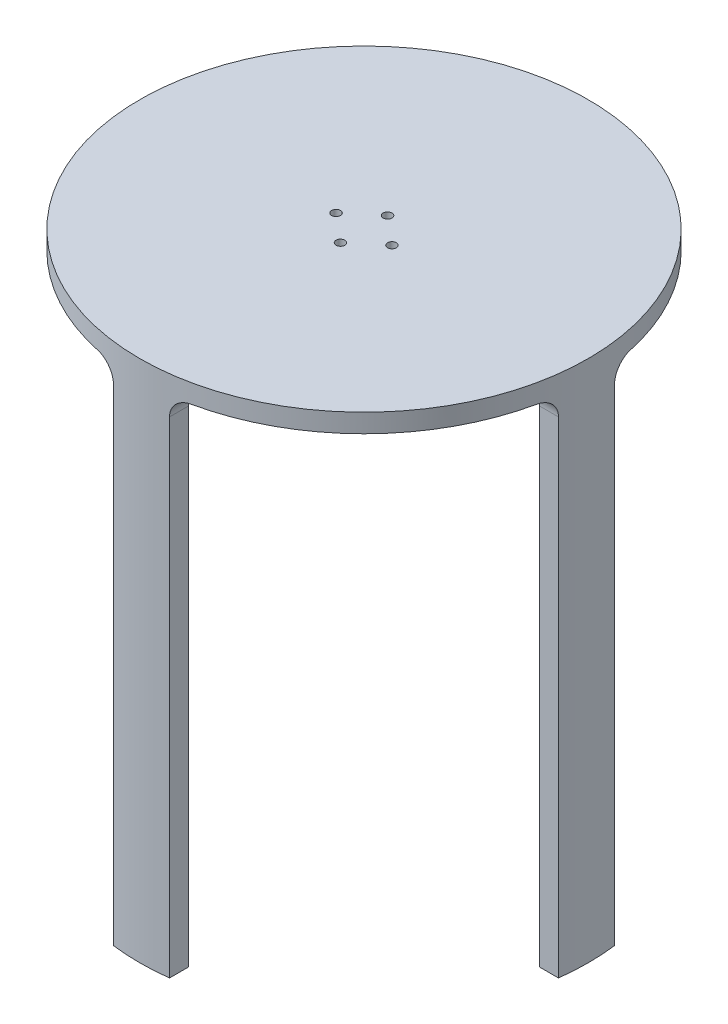
from build123d import *

# Parameters (mm, degrees)
BOSS_EXTRUDE1_DEPTH = 171.45
SKETCH2_R           = 76.2
BOSS_EXTRUDE2_DEPTH = 6.35
SKETCH3_R           = 1.5
CUT_EXTRUDE1_DEPTH  = 6.35
FILLET1_R           = 6.35


with BuildPart() as part:
    # Sketch1 → Boss-Extrude1 (new body)
    with BuildSketch(Plane(origin=(0, 0, 0), x_dir=(1, 0, 0), z_dir=(0, 1, 0))):
        with BuildLine():
            ThreePointArc((-76.2, 0), (-76.050439, -4.771866), (-75.602344, -9.525))
            Line((-75.602344, -9.525), (-69.197521, -9.525))
            ThreePointArc((-69.197521, -9.525), (-69.85, 0), (-69.197521, 9.525))
            Line((-69.197521, 9.525), (-75.602344, 9.525))
            ThreePointArc((-75.602344, 9.525), (-76.050439, 4.771866), (-76.2, 0))
        make_face()
        with BuildLine():
            ThreePointArc((69.85, 0), (69.686689, -4.773661), (69.197521, -9.525))
            Line((69.197521, -9.525), (75.602344, -9.525))
            ThreePointArc((75.602344, -9.525), (76.050439, -4.771866), (76.2, 0))
            ThreePointArc((76.2, 0), (76.050439, 4.771866), (75.602344, 9.525))
            Line((75.602344, 9.525), (69.197521, 9.525))
            ThreePointArc((69.197521, 9.525), (69.686689, 4.773661), (69.85, 0))
        make_face()
        with BuildLine():
            Line((-9.525, -69.197521), (-9.525, -75.602344))
            ThreePointArc((-9.525, -75.602344), (-4.771866, -76.050439), (0, -76.2))
            ThreePointArc((0, -76.2), (4.771866, -76.050439), (9.525, -75.602344))
            Line((9.525, -75.602344), (9.525, -69.197521))
            ThreePointArc((9.525, -69.197521), (0, -69.85), (-9.525, -69.197521))
        make_face()
        with BuildLine():
            ThreePointArc((0, 76.2), (-4.771866, 76.050439), (-9.525, 75.602344))
            Line((-9.525, 75.602344), (-9.525, 69.197521))
            ThreePointArc((-9.525, 69.197521), (0, 69.85), (9.525, 69.197521))
            Line((9.525, 69.197521), (9.525, 75.602344))
            ThreePointArc((9.525, 75.602344), (4.771866, 76.050439), (0, 76.2))
        make_face()
    extrude(amount=BOSS_EXTRUDE1_DEPTH)

    # Sketch2 → Boss-Extrude2 (add)
    with BuildSketch(Plane(origin=(0, 171.45, 0), x_dir=(1, 0, 0), z_dir=(0, 1, 0))):
        with Locations(Location((0, 0, 0), (0, 0, 82.819244))):
            Circle(SKETCH2_R)
    extrude(amount=BOSS_EXTRUDE2_DEPTH)

    # Sketch3 → Cut-Extrude1 (cut)
    with BuildSketch(Plane(origin=(0, 177.8, 0), x_dir=(1, 0, 0), z_dir=(0, 1, 0))):
        with Locations(Location((0, 8, 0), (0, 0, 270))):
            Circle(SKETCH3_R)
        with Locations(Location((9.5, 0, 0), (0, 0, 270))):
            Circle(SKETCH3_R)
        with Locations(Location((0, -8, 0), (0, 0, 270))):
            Circle(SKETCH3_R)
        with Locations(Location((-9.5, 0, 0), (0, 0, 270))):
            Circle(SKETCH3_R)
    extrude(amount=-CUT_EXTRUDE1_DEPTH, mode=Mode.SUBTRACT)

    # Fillet1
    # the kernel refuses this fillet: 6.35 mm, written as the material it adds along each edge
    with BuildSketch(Plane(origin=(-53.322521, 171.45, -9.525), x_dir=(0, 0, -1), z_dir=(-1, 0, 0))) as fillet1_piece_1_section:
        with BuildLine():
            CenterArc((FILLET1_R, FILLET1_R), FILLET1_R, 180, 90)
            Line((0, FILLET1_R), (0, 0))
            Line((0, 0), (FILLET1_R, 0))
        make_face()
    fillet1_piece_1 = extrude(amount=38.154823, mode=Mode.PRIVATE)
    fillet1_piece_1 = fillet1_piece_1 & Plane(origin=(0, 170.014832, 0), x_dir=(0.12500000000000852, 0, -0.9921567416492204), z_dir=(0, -1, 0)) * Cylinder(76.2, 102, mode=Mode.PRIVATE)
    fillet1_piece_1 = fillet1_piece_1 - Plane(origin=(0, 170.014832, 0), x_dir=(-0.9906588508047014, 0, 0.1363636363636162), z_dir=(0, -1, 0)) * Cylinder(69.85, 102, mode=Mode.PRIVATE)
    add(fillet1_piece_1)
    with BuildSketch(Plane(origin=(-91.477344, 171.45, 9.525), x_dir=(0, 0, 1), z_dir=(1, 0, 0))) as fillet1_piece_2_section:
        with BuildLine():
            CenterArc((FILLET1_R, FILLET1_R), FILLET1_R, 180, 90)
            Line((0, FILLET1_R), (0, 0))
            Line((0, 0), (FILLET1_R, 0))
        make_face()
    fillet1_piece_2 = extrude(amount=38.154823, mode=Mode.PRIVATE)
    fillet1_piece_2 = fillet1_piece_2 & Plane(origin=(0, 170.01483, 0), x_dir=(0.12500000000000852, 0, -0.9921567416492204), z_dir=(0, -1, 0)) * Cylinder(76.2, 102, mode=Mode.PRIVATE)
    fillet1_piece_2 = fillet1_piece_2 - Plane(origin=(0, 170.01483, 0), x_dir=(-0.9906588508047014, 0, 0.1363636363636162), z_dir=(0, -1, 0)) * Cylinder(69.85, 102, mode=Mode.PRIVATE)
    add(fillet1_piece_2)
    with BuildSketch(Plane(origin=(0, 171.45, 0), x_dir=(-0.3560760345432726, 0, -0.9344569854326833), z_dir=(-0.9344569854326833, 0, 0.3560760345432726))) as fillet1_piece_3_section:
        with BuildLine():
            CenterArc((69.85 - FILLET1_R, FILLET1_R), FILLET1_R, 270, 90)
            Line((69.85 - FILLET1_R, 0), (69.85, 0))
            Line((69.85, 0), (69.85, FILLET1_R))
        make_face()
    fillet1_piece_3 = revolve(axis=Axis((0, 171.45, 0), (0, -1, 0)), revolution_arc=41.718813, mode=Mode.PRIVATE)
    fillet1_piece_3 = split(fillet1_piece_3, bisect_by=Plane(origin=(9.525, 170.0125, -68.189858), z_dir=(-1, 0, 0)), keep=Keep.TOP, mode=Mode.PRIVATE)
    fillet1_piece_3 = split(fillet1_piece_3, bisect_by=Plane(origin=(-9.525, 170.0125, -68.189858), z_dir=(1, 0, 0)), keep=Keep.TOP, mode=Mode.PRIVATE)
    add(fillet1_piece_3)
    with BuildSketch(Plane(origin=(-9.525, 171.45, -91.477344), x_dir=(-1, 0, 0), z_dir=(0, 0, 1))) as fillet1_piece_4_section:
        with BuildLine():
            CenterArc((FILLET1_R, FILLET1_R), FILLET1_R, 180, 90)
            Line((0, FILLET1_R), (0, 0))
            Line((0, 0), (FILLET1_R, 0))
        make_face()
    fillet1_piece_4 = extrude(amount=38.154823, mode=Mode.PRIVATE)
    fillet1_piece_4 = fillet1_piece_4 - Plane(origin=(0, 170.014822, 0), x_dir=(-0.13636363636364177, 0, -0.9906588508046978), z_dir=(0, -1, 0)) * Cylinder(69.85, 102, mode=Mode.PRIVATE)
    fillet1_piece_4 = fillet1_piece_4 & Plane(origin=(0, 170.014822, 0), x_dir=(0.12500000000000852, 0, -0.9921567416492204), z_dir=(0, -1, 0)) * Cylinder(76.2, 102, mode=Mode.PRIVATE)
    add(fillet1_piece_4)
    with BuildSketch(Plane(origin=(9.525, 171.45, -53.322521), x_dir=(0, -1, 0), z_dir=(0, 0, -1))) as fillet1_piece_5_section:
        with BuildLine():
            CenterArc((FILLET1_R, -FILLET1_R), FILLET1_R, 90, 90)
            Line((0, -FILLET1_R), (0, 0))
            Line((0, 0), (FILLET1_R, 0))
        make_face()
    fillet1_piece_5 = extrude(amount=38.154823, mode=Mode.PRIVATE)
    fillet1_piece_5 = fillet1_piece_5 - Plane(origin=(0, 170.014825, 0), x_dir=(-0.13636363636364177, 0, -0.9906588508046978), z_dir=(0, -1, 0)) * Cylinder(69.85, 102, mode=Mode.PRIVATE)
    fillet1_piece_5 = fillet1_piece_5 & Plane(origin=(0, 170.014825, 0), x_dir=(0.12500000000000852, 0, -0.9921567416492204), z_dir=(0, -1, 0)) * Cylinder(76.2, 102, mode=Mode.PRIVATE)
    add(fillet1_piece_5)
    with BuildSketch(Plane(origin=(0, 171.45, 0), x_dir=(0.9344569854326804, 0, 0.35607603454328035), z_dir=(-0.35607603454328035, 0, 0.9344569854326804))) as fillet1_piece_6_section:
        with BuildLine():
            CenterArc((69.85 - FILLET1_R, -FILLET1_R), FILLET1_R, 0, 90)
            Line((69.85, -FILLET1_R), (69.85, 0))
            Line((69.85, 0), (69.85 - FILLET1_R, 0))
        make_face()
    fillet1_piece_6 = revolve(axis=Axis((0, 171.45, 0), (0, 1, 0)), revolution_arc=41.718813, mode=Mode.PRIVATE)
    fillet1_piece_6 = split(fillet1_piece_6, bisect_by=Plane(origin=(68.189858, 170.0125, -9.525), z_dir=(0, 0, 1)), keep=Keep.TOP, mode=Mode.PRIVATE)
    fillet1_piece_6 = split(fillet1_piece_6, bisect_by=Plane(origin=(68.189858, 170.0125, 9.525), z_dir=(0, 0, -1)), keep=Keep.TOP, mode=Mode.PRIVATE)
    add(fillet1_piece_6)
    with BuildSketch(Plane(origin=(91.477344, 171.45, -9.525), x_dir=(0, 0, -1), z_dir=(-1, 0, 0))) as fillet1_piece_7_section:
        with BuildLine():
            CenterArc((FILLET1_R, FILLET1_R), FILLET1_R, 180, 90)
            Line((0, FILLET1_R), (0, 0))
            Line((0, 0), (FILLET1_R, 0))
        make_face()
    fillet1_piece_7 = extrude(amount=38.154823, mode=Mode.PRIVATE)
    fillet1_piece_7 = fillet1_piece_7 & Plane(origin=(0, 170.014822, 0), x_dir=(0.12500000000000852, 0, -0.9921567416492204), z_dir=(0, -1, 0)) * Cylinder(76.2, 102, mode=Mode.PRIVATE)
    fillet1_piece_7 = fillet1_piece_7 - Plane(origin=(0, 170.014822, 0), x_dir=(0.9906588508046978, 0, -0.1363636363636413), z_dir=(0, -1, 0)) * Cylinder(69.85, 102, mode=Mode.PRIVATE)
    add(fillet1_piece_7)
    with BuildSketch(Plane(origin=(53.322521, 171.45, 9.525), x_dir=(0, 0, 1), z_dir=(1, 0, 0))) as fillet1_piece_8_section:
        with BuildLine():
            CenterArc((FILLET1_R, FILLET1_R), FILLET1_R, 180, 90)
            Line((0, FILLET1_R), (0, 0))
            Line((0, 0), (FILLET1_R, 0))
        make_face()
    fillet1_piece_8 = extrude(amount=38.154823, mode=Mode.PRIVATE)
    fillet1_piece_8 = fillet1_piece_8 & Plane(origin=(0, 170.014832, 0), x_dir=(0.12500000000000852, 0, -0.9921567416492204), z_dir=(0, -1, 0)) * Cylinder(76.2, 102, mode=Mode.PRIVATE)
    fillet1_piece_8 = fillet1_piece_8 - Plane(origin=(0, 170.014832, 0), x_dir=(0.9906588508046978, 0, -0.1363636363636413), z_dir=(0, -1, 0)) * Cylinder(69.85, 102, mode=Mode.PRIVATE)
    add(fillet1_piece_8)
    with BuildSketch(Plane(origin=(0, 171.45, 0), x_dir=(0.3560760345432569, 0, 0.9344569854326892), z_dir=(0.9344569854326892, 0, -0.3560760345432569))) as fillet1_piece_9_section:
        with BuildLine():
            CenterArc((69.85 - FILLET1_R, FILLET1_R), FILLET1_R, 270, 90)
            Line((69.85, FILLET1_R), (69.85, 0))
            Line((69.85, 0), (69.85 - FILLET1_R, 0))
        make_face()
    fillet1_piece_9 = revolve(axis=Axis((0, 171.45, 0), (0, -1, 0)), revolution_arc=41.718813, mode=Mode.PRIVATE)
    fillet1_piece_9 = split(fillet1_piece_9, bisect_by=Plane(origin=(9.525, 170.0125, 68.189858), z_dir=(-1, 0, 0)), keep=Keep.TOP, mode=Mode.PRIVATE)
    fillet1_piece_9 = split(fillet1_piece_9, bisect_by=Plane(origin=(-9.525, 170.0125, 68.189858), z_dir=(1, 0, 0)), keep=Keep.TOP, mode=Mode.PRIVATE)
    add(fillet1_piece_9)
    with BuildSketch(Plane(origin=(-9.525, 171.45, 53.322521), x_dir=(-1, 0, 0), z_dir=(0, 0, 1))) as fillet1_piece_10_section:
        with BuildLine():
            CenterArc((FILLET1_R, FILLET1_R), FILLET1_R, 180, 90)
            Line((0, FILLET1_R), (0, 0))
            Line((0, 0), (FILLET1_R, 0))
        make_face()
    fillet1_piece_10 = extrude(amount=38.154823, mode=Mode.PRIVATE)
    fillet1_piece_10 = fillet1_piece_10 & Plane(origin=(0, 170.014832, 0), x_dir=(0.12500000000000852, 0, -0.9921567416492204), z_dir=(0, -1, 0)) * Cylinder(76.2, 102, mode=Mode.PRIVATE)
    fillet1_piece_10 = fillet1_piece_10 - Plane(origin=(0, 170.014832, 0), x_dir=(0.13636363636361964, 0, 0.9906588508047008), z_dir=(0, -1, 0)) * Cylinder(69.85, 102, mode=Mode.PRIVATE)
    add(fillet1_piece_10)
    with BuildSketch(Plane(origin=(9.525, 171.45, 91.477344), x_dir=(1, 0, 0), z_dir=(0, 0, -1))) as fillet1_piece_11_section:
        with BuildLine():
            CenterArc((FILLET1_R, FILLET1_R), FILLET1_R, 180, 90)
            Line((0, FILLET1_R), (0, 0))
            Line((0, 0), (FILLET1_R, 0))
        make_face()
    fillet1_piece_11 = extrude(amount=38.154823, mode=Mode.PRIVATE)
    fillet1_piece_11 = fillet1_piece_11 & Plane(origin=(0, 170.014834, 0), x_dir=(0.12500000000000852, 0, -0.9921567416492204), z_dir=(0, -1, 0)) * Cylinder(76.2, 102, mode=Mode.PRIVATE)
    fillet1_piece_11 = fillet1_piece_11 - Plane(origin=(0, 170.014834, 0), x_dir=(0.13636363636361964, 0, 0.9906588508047008), z_dir=(0, -1, 0)) * Cylinder(69.85, 102, mode=Mode.PRIVATE)
    add(fillet1_piece_11)
    with BuildSketch(Plane(origin=(0, 171.45, 0), x_dir=(-0.934456985432693, 0, 0.35607603454324743), z_dir=(0.35607603454324743, 0, 0.934456985432693))) as fillet1_piece_12_section:
        with BuildLine():
            CenterArc((69.85 - FILLET1_R, FILLET1_R), FILLET1_R, 270, 90)
            Line((69.85, FILLET1_R), (69.85, 0))
            Line((69.85, 0), (69.85 - FILLET1_R, 0))
        make_face()
    fillet1_piece_12 = revolve(axis=Axis((0, 171.45, 0), (0, -1, 0)), revolution_arc=41.718813, mode=Mode.PRIVATE)
    fillet1_piece_12 = split(fillet1_piece_12, bisect_by=Plane(origin=(-68.189858, 170.0125, 9.525), z_dir=(0, 0, -1)), keep=Keep.TOP, mode=Mode.PRIVATE)
    fillet1_piece_12 = split(fillet1_piece_12, bisect_by=Plane(origin=(-68.189858, 170.0125, -9.525), z_dir=(0, 0, 1)), keep=Keep.TOP, mode=Mode.PRIVATE)
    add(fillet1_piece_12)
    with BuildSketch(Plane(origin=(-53.322521, 171.45, -9.525), x_dir=(0, 0, -1), z_dir=(-1, 0, 0))) as fillet1_piece_13a_section:
        with BuildLine():
            CenterArc((FILLET1_R, FILLET1_R), FILLET1_R, 180, 90)
            Line((0, FILLET1_R), (0, 0))
            Line((0, 0), (FILLET1_R, 0))
        make_face()
    fillet1_piece_13a = extrude(amount=38.154823, mode=Mode.PRIVATE)
    fillet1_piece_13a = fillet1_piece_13a & Plane(origin=(0, 170.000683, 0), x_dir=(-0.9906588508047014, 0, 0.1363636363636162), z_dir=(0, -1, 0)) * Cylinder(69.85, 102, mode=Mode.PRIVATE)
    with BuildSketch(Plane(origin=(0, 171.45, 0), x_dir=(-0.934456985432693, 0, 0.35607603454324743), z_dir=(0.35607603454324743, 0, 0.934456985432693))) as fillet1_piece_13b_section:
        with BuildLine():
            CenterArc((69.85 - FILLET1_R, FILLET1_R), FILLET1_R, 270, 90)
            Line((69.85, FILLET1_R), (69.85, 0))
            Line((69.85, 0), (69.85 - FILLET1_R, 0))
        make_face()
    fillet1_piece_13b = revolve(axis=Axis((0, 171.45, 0), (0, -1, 0)), revolution_arc=41.718813, mode=Mode.PRIVATE)
    fillet1_piece_13b = split(fillet1_piece_13b, bisect_by=Plane(origin=(-66.158519, 169.986066, -9.525), z_dir=(0, 0, -1)), keep=Keep.TOP, mode=Mode.PRIVATE)
    fillet1_piece_13 = fillet1_piece_13a & fillet1_piece_13b
    add(fillet1_piece_13)
    with BuildSketch(Plane(origin=(0, 171.45, 0), x_dir=(-0.934456985432693, 0, 0.35607603454324743), z_dir=(0.35607603454324743, 0, 0.934456985432693))) as fillet1_piece_14a_section:
        with BuildLine():
            CenterArc((69.85 - FILLET1_R, FILLET1_R), FILLET1_R, 270, 90)
            Line((69.85, FILLET1_R), (69.85, 0))
            Line((69.85, 0), (69.85 - FILLET1_R, 0))
        make_face()
    fillet1_piece_14a = revolve(axis=Axis((0, 171.45, 0), (0, -1, 0)), revolution_arc=41.718813, mode=Mode.PRIVATE)
    fillet1_piece_14a = split(fillet1_piece_14a, bisect_by=Plane(origin=(-66.158518, 169.986066, 9.525), z_dir=(0, 0, 1)), keep=Keep.TOP, mode=Mode.PRIVATE)
    with BuildSketch(Plane(origin=(-91.477344, 171.45, 9.525), x_dir=(0, 0, 1), z_dir=(1, 0, 0))) as fillet1_piece_14b_section:
        with BuildLine():
            CenterArc((FILLET1_R, FILLET1_R), FILLET1_R, 180, 90)
            Line((0, FILLET1_R), (0, 0))
            Line((0, 0), (FILLET1_R, 0))
        make_face()
    fillet1_piece_14b = extrude(amount=38.154823, mode=Mode.PRIVATE)
    fillet1_piece_14b = fillet1_piece_14b & Plane(origin=(0, 170.000696, 0), x_dir=(-0.9906588508047014, 0, 0.1363636363636162), z_dir=(0, -1, 0)) * Cylinder(69.85, 102, mode=Mode.PRIVATE)
    fillet1_piece_14 = fillet1_piece_14a & fillet1_piece_14b
    add(fillet1_piece_14)
    with BuildSketch(Plane(origin=(0, 171.45, 0), x_dir=(-0.3560760345432726, 0, -0.9344569854326833), z_dir=(-0.9344569854326833, 0, 0.3560760345432726))) as fillet1_piece_15a_section:
        with BuildLine():
            CenterArc((69.85 - FILLET1_R, FILLET1_R), FILLET1_R, 270, 90)
            Line((69.85 - FILLET1_R, 0), (69.85, 0))
            Line((69.85, 0), (69.85, FILLET1_R))
        make_face()
    fillet1_piece_15a = revolve(axis=Axis((0, 171.45, 0), (0, -1, 0)), revolution_arc=41.718813, mode=Mode.PRIVATE)
    fillet1_piece_15a = split(fillet1_piece_15a, bisect_by=Plane(origin=(-9.525, 169.986066, -66.158518), z_dir=(-1, 0, 0)), keep=Keep.TOP, mode=Mode.PRIVATE)
    with BuildSketch(Plane(origin=(-9.525, 171.45, -91.477344), x_dir=(-1, 0, 0), z_dir=(0, 0, 1))) as fillet1_piece_15b_section:
        with BuildLine():
            CenterArc((FILLET1_R, FILLET1_R), FILLET1_R, 180, 90)
            Line((0, FILLET1_R), (0, 0))
            Line((0, 0), (FILLET1_R, 0))
        make_face()
    fillet1_piece_15b = extrude(amount=38.154823, mode=Mode.PRIVATE)
    fillet1_piece_15b = fillet1_piece_15b & Plane(origin=(0, 170.000687, 0), x_dir=(-0.13636363636364177, 0, -0.9906588508046978), z_dir=(0, -1, 0)) * Cylinder(69.85, 102, mode=Mode.PRIVATE)
    fillet1_piece_15 = fillet1_piece_15a & fillet1_piece_15b
    add(fillet1_piece_15)
    with BuildSketch(Plane(origin=(9.525, 171.45, -53.322521), x_dir=(0, -1, 0), z_dir=(0, 0, -1))) as fillet1_piece_16a_section:
        with BuildLine():
            CenterArc((FILLET1_R, -FILLET1_R), FILLET1_R, 90, 90)
            Line((0, -FILLET1_R), (0, 0))
            Line((0, 0), (FILLET1_R, 0))
        make_face()
    fillet1_piece_16a = extrude(amount=38.154823, mode=Mode.PRIVATE)
    fillet1_piece_16a = fillet1_piece_16a & Plane(origin=(0, 170.000687, 0), x_dir=(-0.13636363636364177, 0, -0.9906588508046978), z_dir=(0, -1, 0)) * Cylinder(69.85, 102, mode=Mode.PRIVATE)
    with BuildSketch(Plane(origin=(0, 171.45, 0), x_dir=(-0.3560760345432726, 0, -0.9344569854326833), z_dir=(-0.9344569854326833, 0, 0.3560760345432726))) as fillet1_piece_16b_section:
        with BuildLine():
            CenterArc((69.85 - FILLET1_R, FILLET1_R), FILLET1_R, 270, 90)
            Line((69.85 - FILLET1_R, 0), (69.85, 0))
            Line((69.85, 0), (69.85, FILLET1_R))
        make_face()
    fillet1_piece_16b = revolve(axis=Axis((0, 171.45, 0), (0, -1, 0)), revolution_arc=41.718813, mode=Mode.PRIVATE)
    fillet1_piece_16b = split(fillet1_piece_16b, bisect_by=Plane(origin=(9.525, 169.986066, -66.158519), z_dir=(1, 0, 0)), keep=Keep.TOP, mode=Mode.PRIVATE)
    fillet1_piece_16 = fillet1_piece_16a & fillet1_piece_16b
    add(fillet1_piece_16)
    with BuildSketch(Plane(origin=(0, 171.45, 0), x_dir=(0.9344569854326804, 0, 0.35607603454328035), z_dir=(-0.35607603454328035, 0, 0.9344569854326804))) as fillet1_piece_17a_section:
        with BuildLine():
            CenterArc((69.85 - FILLET1_R, -FILLET1_R), FILLET1_R, 0, 90)
            Line((69.85, -FILLET1_R), (69.85, 0))
            Line((69.85, 0), (69.85 - FILLET1_R, 0))
        make_face()
    fillet1_piece_17a = revolve(axis=Axis((0, 171.45, 0), (0, 1, 0)), revolution_arc=41.718813, mode=Mode.PRIVATE)
    fillet1_piece_17a = split(fillet1_piece_17a, bisect_by=Plane(origin=(66.158518, 169.986066, 9.525), z_dir=(0, 0, 1)), keep=Keep.TOP, mode=Mode.PRIVATE)
    with BuildSketch(Plane(origin=(53.322521, 171.45, 9.525), x_dir=(0, 0, 1), z_dir=(1, 0, 0))) as fillet1_piece_17b_section:
        with BuildLine():
            CenterArc((FILLET1_R, FILLET1_R), FILLET1_R, 180, 90)
            Line((0, FILLET1_R), (0, 0))
            Line((0, 0), (FILLET1_R, 0))
        make_face()
    fillet1_piece_17b = extrude(amount=38.154823, mode=Mode.PRIVATE)
    fillet1_piece_17b = fillet1_piece_17b & Plane(origin=(0, 170.000683, 0), x_dir=(0.9906588508046978, 0, -0.1363636363636413), z_dir=(0, -1, 0)) * Cylinder(69.85, 102, mode=Mode.PRIVATE)
    fillet1_piece_17 = fillet1_piece_17a & fillet1_piece_17b
    add(fillet1_piece_17)
    with BuildSketch(Plane(origin=(91.477344, 171.45, -9.525), x_dir=(0, 0, -1), z_dir=(-1, 0, 0))) as fillet1_piece_18a_section:
        with BuildLine():
            CenterArc((FILLET1_R, FILLET1_R), FILLET1_R, 180, 90)
            Line((0, FILLET1_R), (0, 0))
            Line((0, 0), (FILLET1_R, 0))
        make_face()
    fillet1_piece_18a = extrude(amount=38.154823, mode=Mode.PRIVATE)
    fillet1_piece_18a = fillet1_piece_18a & Plane(origin=(0, 170.000687, 0), x_dir=(0.9906588508046978, 0, -0.1363636363636413), z_dir=(0, -1, 0)) * Cylinder(69.85, 102, mode=Mode.PRIVATE)
    with BuildSketch(Plane(origin=(0, 171.45, 0), x_dir=(0.9344569854326804, 0, 0.35607603454328035), z_dir=(-0.35607603454328035, 0, 0.9344569854326804))) as fillet1_piece_18b_section:
        with BuildLine():
            CenterArc((69.85 - FILLET1_R, -FILLET1_R), FILLET1_R, 0, 90)
            Line((69.85, -FILLET1_R), (69.85, 0))
            Line((69.85, 0), (69.85 - FILLET1_R, 0))
        make_face()
    fillet1_piece_18b = revolve(axis=Axis((0, 171.45, 0), (0, 1, 0)), revolution_arc=41.718813, mode=Mode.PRIVATE)
    fillet1_piece_18b = split(fillet1_piece_18b, bisect_by=Plane(origin=(66.158519, 169.986066, -9.525), z_dir=(0, 0, -1)), keep=Keep.TOP, mode=Mode.PRIVATE)
    fillet1_piece_18 = fillet1_piece_18a & fillet1_piece_18b
    add(fillet1_piece_18)
    with BuildSketch(Plane(origin=(0, 171.45, 0), x_dir=(0.3560760345432569, 0, 0.9344569854326892), z_dir=(0.9344569854326892, 0, -0.3560760345432569))) as fillet1_piece_19a_section:
        with BuildLine():
            CenterArc((69.85 - FILLET1_R, FILLET1_R), FILLET1_R, 270, 90)
            Line((69.85, FILLET1_R), (69.85, 0))
            Line((69.85, 0), (69.85 - FILLET1_R, 0))
        make_face()
    fillet1_piece_19a = revolve(axis=Axis((0, 171.45, 0), (0, -1, 0)), revolution_arc=41.718813, mode=Mode.PRIVATE)
    fillet1_piece_19a = split(fillet1_piece_19a, bisect_by=Plane(origin=(9.525, 169.986066, 66.158518), z_dir=(1, 0, 0)), keep=Keep.TOP, mode=Mode.PRIVATE)
    with BuildSketch(Plane(origin=(9.525, 171.45, 91.477344), x_dir=(1, 0, 0), z_dir=(0, 0, -1))) as fillet1_piece_19b_section:
        with BuildLine():
            CenterArc((FILLET1_R, FILLET1_R), FILLET1_R, 180, 90)
            Line((0, FILLET1_R), (0, 0))
            Line((0, 0), (FILLET1_R, 0))
        make_face()
    fillet1_piece_19b = extrude(amount=38.154823, mode=Mode.PRIVATE)
    fillet1_piece_19b = fillet1_piece_19b & Plane(origin=(0, 170.000696, 0), x_dir=(0.13636363636361964, 0, 0.9906588508047008), z_dir=(0, -1, 0)) * Cylinder(69.85, 102, mode=Mode.PRIVATE)
    fillet1_piece_19 = fillet1_piece_19a & fillet1_piece_19b
    add(fillet1_piece_19)
    with BuildSketch(Plane(origin=(-9.525, 171.45, 53.322521), x_dir=(-1, 0, 0), z_dir=(0, 0, 1))) as fillet1_piece_20a_section:
        with BuildLine():
            CenterArc((FILLET1_R, FILLET1_R), FILLET1_R, 180, 90)
            Line((0, FILLET1_R), (0, 0))
            Line((0, 0), (FILLET1_R, 0))
        make_face()
    fillet1_piece_20a = extrude(amount=38.154823, mode=Mode.PRIVATE)
    fillet1_piece_20a = fillet1_piece_20a & Plane(origin=(0, 170.000683, 0), x_dir=(0.13636363636361964, 0, 0.9906588508047008), z_dir=(0, -1, 0)) * Cylinder(69.85, 102, mode=Mode.PRIVATE)
    with BuildSketch(Plane(origin=(0, 171.45, 0), x_dir=(0.3560760345432569, 0, 0.9344569854326892), z_dir=(0.9344569854326892, 0, -0.3560760345432569))) as fillet1_piece_20b_section:
        with BuildLine():
            CenterArc((69.85 - FILLET1_R, FILLET1_R), FILLET1_R, 270, 90)
            Line((69.85, FILLET1_R), (69.85, 0))
            Line((69.85, 0), (69.85 - FILLET1_R, 0))
        make_face()
    fillet1_piece_20b = revolve(axis=Axis((0, 171.45, 0), (0, -1, 0)), revolution_arc=41.718813, mode=Mode.PRIVATE)
    fillet1_piece_20b = split(fillet1_piece_20b, bisect_by=Plane(origin=(-9.525, 169.986066, 66.158519), z_dir=(-1, 0, 0)), keep=Keep.TOP, mode=Mode.PRIVATE)
    fillet1_piece_20 = fillet1_piece_20a & fillet1_piece_20b
    add(fillet1_piece_20)


solid = part.part
